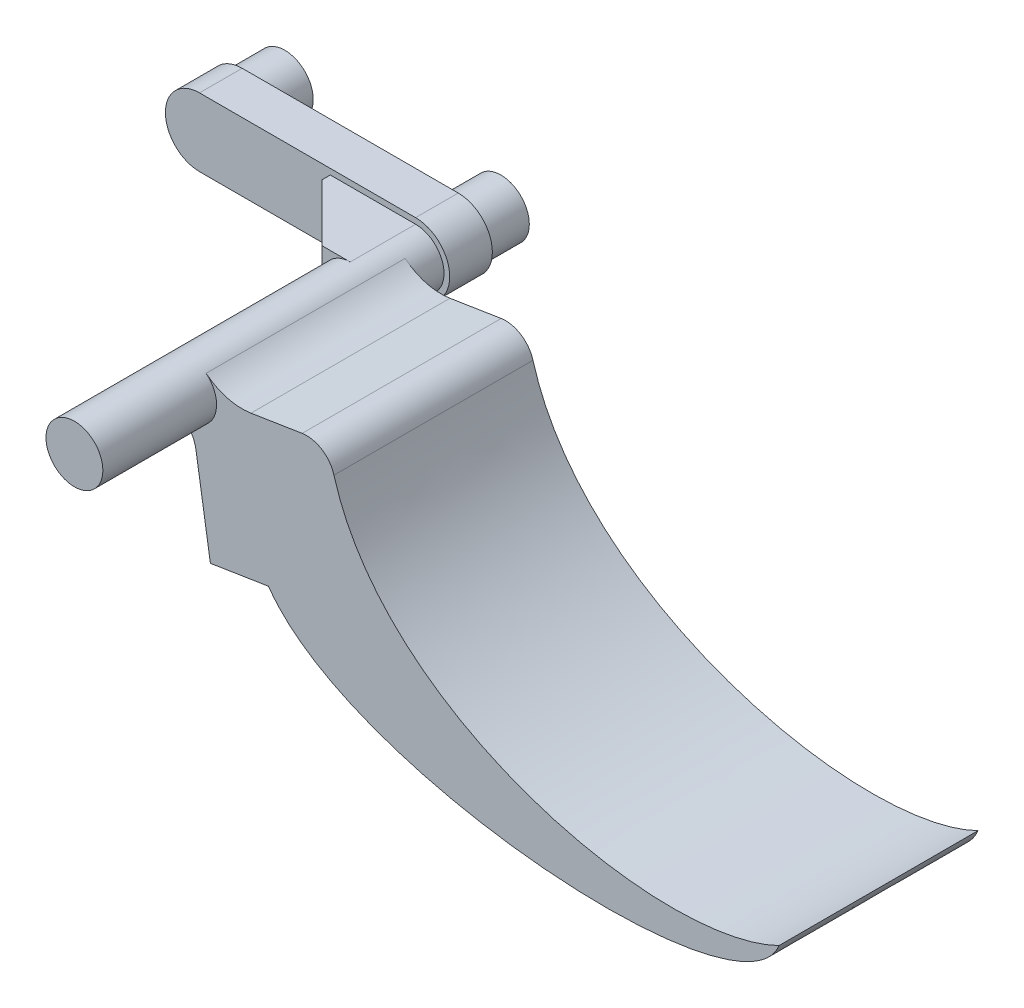
from build123d import *

# Parameters (mm, degrees)
SKETCH_1_R      = 1
EXTRUDE_1_DEPTH = 15
EXTRUDE_2_DEPTH = 1.5
SKETCH_3_R      = 1
EXTRUDE_3_DEPTH = 3
SKETCH_4_W      = 3
SKETCH_4_H      = 2
EXTRUDE_4_DEPTH = 2.3
EXTRUDE_5_DEPTH = 7
EXTRUDE_6_DEPTH = 7
FILLET_1_R      = 1
FILLET_2_R      = 1
FILLET_3_R      = 2
CHAMFER_2_SIZE  = 2


# Some blends are built 0.0001 mm under size
with BuildPart() as part:
    # Эскиз1 → Бобышка-Вытянуть1 (new body)
    with BuildSketch(Plane.XY):
        Circle(SKETCH_1_R)
    extrude(amount=EXTRUDE_1_DEPTH)

    # Эскиз2 → Бобышка-Вытянуть2 (add)
    with BuildSketch(Plane(origin=(0, 0, 1.5), x_dir=(-1, 0, 0), z_dir=(0, 0, -1))):
        with BuildLine():
            Line((0, 1.201036303), (7.6, 1.201036303))
            ThreePointArc((7.6, 1.201036303), (8.8, 0.001036303), (7.6, -1.198963697))
            Line((7.6, -1.198963697), (0, -1.198963697))
            ThreePointArc((0, -1.198963697), (-1.2, 0.001036303), (0, 1.201036303))
        make_face()
    extrude(amount=-EXTRUDE_2_DEPTH)

    # Эскиз3 → Бобышка-Вытянуть3 (add)
    with BuildSketch(Plane.XY.offset(3)):
        with Locations((-7.6, 0.001036303)):
            Circle(SKETCH_3_R)
    extrude(amount=-EXTRUDE_3_DEPTH)

    # Эскиз4 → Бобышка-Вытянуть4 (add)
    with BuildSketch(Plane.XY.offset(3)):
        with Locations((-1.5, 0)):
            Rectangle(SKETCH_4_W, SKETCH_4_H)
    extrude(amount=EXTRUDE_4_DEPTH)

    # Эскиз5 → Бобышка-Вытянуть5 (add)
    with BuildSketch(Plane(origin=(0, 0, 4), x_dir=(-1, 0, 0), z_dir=(0, 0, -1))):
        Polygon((0, 0), (-0.782172325, -4.938441703), (-5.720614028, -4.156269378), (-4.938441703, 0.782172325), align=None)
    extrude(amount=-EXTRUDE_5_DEPTH)

    # Эскиз6 → Бобышка-Вытянуть6 (add)
    with BuildSketch(Plane(origin=(0, 0, 4), x_dir=(-1, 0, 0), z_dir=(0, 0, -1))):
        with BuildLine():
            Line((-0.987688341, 0.156434465), (-4.938441703, 0.782172325))
            add(Edge.make_bspline(
                [(-4.938441703, 0.782172325), (-6.035924713, -6.147062691), (-16.447307855, -8.707880394), (-20.782172325, -6.582481038)],
                knots=[0, 0, 0, 0, 1, 1, 1, 1], degree=3))
            add(Edge.make_bspline(
                [(-20.782172325, -6.582481038), (-19.502585952, -9.761328662), (-5.677351674, -8.787425093), (-2.826630593, -4.614631324)],
                knots=[0, 0, 0, 0, 1, 1, 1, 1], degree=3))
            Line((-2.826630593, -4.614631324), (-0.782172325, -4.938441703))
            Line((-0.782172325, -4.938441703), (-0.156434465, -0.987688341))
            ThreePointArc((-0.156434465, -0.987688341), (-0.809016994, -0.587785252), (-0.987688341, 0.156434465))
        make_face()
    extrude(amount=-EXTRUDE_6_DEPTH)

    # Скругление1
    fillet_1_edges = [part.edges().sort_by_distance(p)[0] for p in [
        (4.938441703, 0.782172325, 7.5),
    ]]
    fillet(fillet_1_edges, radius=FILLET_1_R)

    # Скругление2
    # the kernel refuses this fillet: 1 mm, written as the material it adds along each edge
    with BuildSketch(Plane(origin=(0.156434465, -0.987688341, 11), x_dir=(-0.9945218953682737, 0.10452846326764978, 0), z_dir=(0, 0, -1))) as fillet_2_piece_1:
        with BuildLine():
            CenterArc((0.776457135, -0.965925826), FILLET_2_R, 105, 60)
            Line((-0.189468691, -0.707106781), (-0.208787208, -0.7019304))
            Line((-0.208787208, -0.7019304), (-0.019318517, 0.005176381))
            Line((-0.019318517, 0.005176381), (0.005176381, 0.019318517))
            ThreePointArc((0.005176381, 0.019318517), (0.258819045, -0.014074174), (0.512461709, 0.019318517))
            Line((0.512461709, 0.019318517), (0.51763809, 0))
        make_face()
    extrude(amount=7)

    # Скругление3
    fillet_3_edges = [part.edges().sort_by_distance(p)[0] for p in [
        (0.987688341, 0.156434465, 7.5),
    ]]
    fillet(fillet_3_edges, radius=FILLET_3_R)

    # Фаска2
    chamfer_2_edges = [part.edges().sort_by_distance(p)[0] for p in [
        (-3, 0, 5.3),
    ]]
    chamfer(chamfer_2_edges, length=CHAMFER_2_SIZE - 0.0001)  # a hair under: the kernel refuses the full size


solid = part.part
